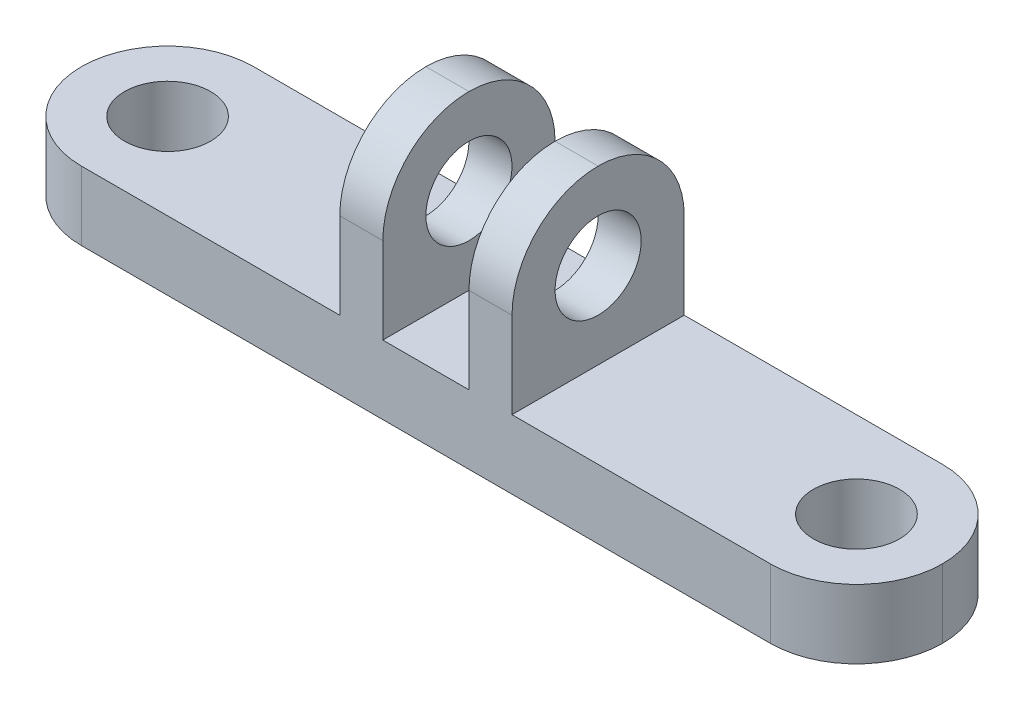
from build123d import *

# Parameters (mm, degrees)
SKETCH2_W               = 31.75
SKETCH2_H               = 6.35
SKETCH2_R               = 1.5875
BOSS_EXTRUDE1_DEPTH     = 2.54
SKETCH3_W               = 1.5875
SKETCH3_H               = 6.35
BOSS_EXTRUDE2_DEPTH     = 6.35
CUT_EXTRUDE1_DEPTH      = 20.850733771
CUT_EXTRUDE1_DEPTH_BACK = 20.850733771
SKETCH4_R               = 1.5875
FILLET1_R               = 3.175


with BuildPart() as part:
    # Sketch2 → Boss-Extrude1 (new body)
    with BuildSketch(Plane(origin=(0, 0, 0), x_dir=(1, 0, 0), z_dir=(0, 1, 0))):
        Rectangle(SKETCH2_W, SKETCH2_H)
        with Locations(Location((-12.7, 0, 0), (0, 0, 270))):
            Circle(SKETCH2_R, mode=Mode.SUBTRACT)
        with Locations(Location((12.7, 0, 0), (0, 0, 270))):
            Circle(SKETCH2_R, mode=Mode.SUBTRACT)
    extrude(amount=BOSS_EXTRUDE1_DEPTH)

    # Sketch3 → Boss-Extrude2 (add)
    with BuildSketch(Plane(origin=(0, 2.54, 0), x_dir=(1, 0, 0), z_dir=(0, 1, 0))):
        with Locations((-2.38125, 0)):
            Rectangle(SKETCH3_W, SKETCH3_H)
        with Locations((2.38125, 0)):
            Rectangle(SKETCH3_W, SKETCH3_H)
    extrude(amount=BOSS_EXTRUDE2_DEPTH)

    # Sketch4 → Cut-Extrude1 (cut, two sides: drawn at the far end of the back side and taken through both)
    with BuildSketch(Plane(origin=(-1.5875, 0, 0), x_dir=(0, 0, -1), z_dir=(1, 0, 0)).offset(-CUT_EXTRUDE1_DEPTH_BACK)):
        with Locations((0, 5.715)):
            Circle(SKETCH4_R)
    extrude(amount=CUT_EXTRUDE1_DEPTH + CUT_EXTRUDE1_DEPTH_BACK, mode=Mode.SUBTRACT)

    # Fillet1
    fillet1_edges = [part.edges().sort_by_distance(p)[0] for p in [
        (-15.875, 1.27, 3.175),
        (-15.875, 1.27, -3.175),
        (15.875, 1.27, -3.175),
        (15.875, 1.27, 3.175),
        (2.38125, 8.89, 3.175),
        (2.38125, 8.89, -3.175),
        (-2.38125, 8.89, -3.175),
        (-2.38125, 8.89, 3.175),
    ]]
    fillet(fillet1_edges, radius=FILLET1_R - 0.0001)  # a hair under: the kernel refuses the full size


solid = part.part
